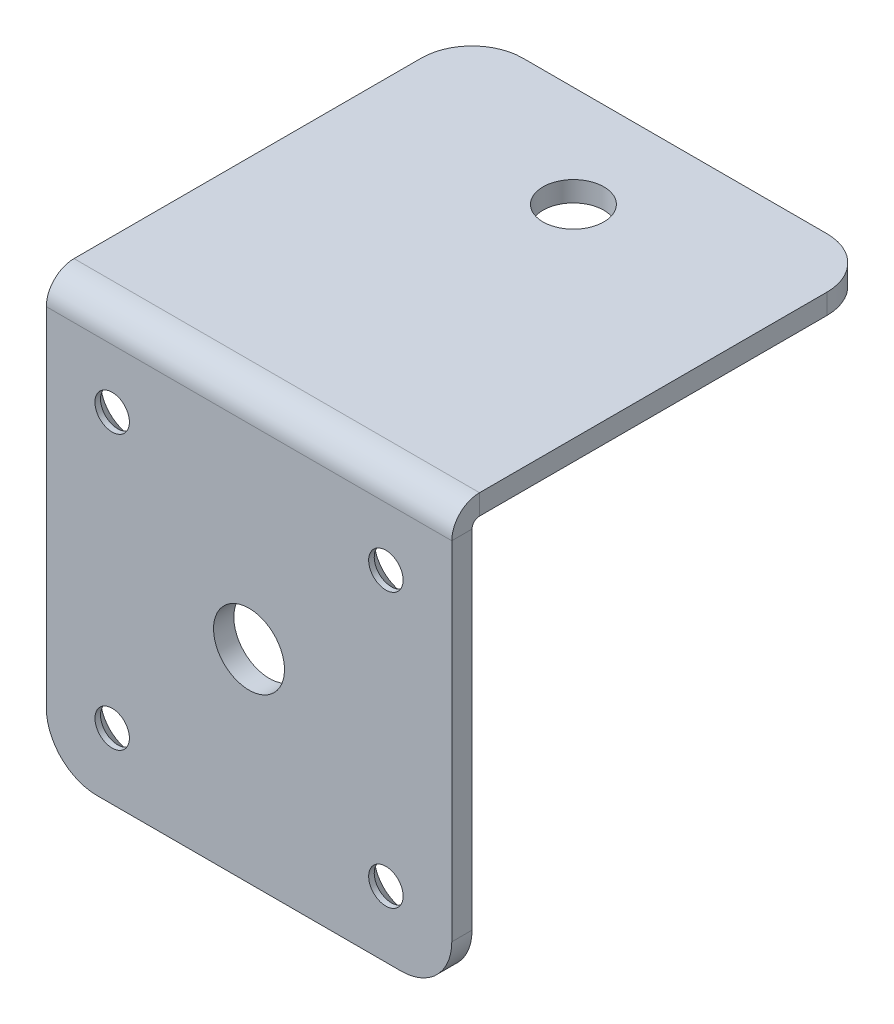
from build123d import *

# Parameters (mm, degrees)
SKETCH_1_W                       = 40
SKETCH_1_H                       = 2
SM_BASE_FLANGE_1_DEPTH           = 40
CUT_EXTRUDE_1_REACH              = 58.604
SKETCH_3_R                       = 3
SM_EDGE_FLANGE_1_STRIP_W         = 9.4732
SM_EDGE_FLANGE_1_STRIP_H         = 2
SM_EDGE_FLANGE_1_STRIP_CUT_DEPTH = 40
SM_EDGE_FLANGE_1_DEPTH           = 40
FILLET_1_R                       = 5
HOLE_WIZARD_M3_1_AT_2_COUNT      = 2
HOLE_WIZARD_M3_1_AT_2_PITCH      = 27
HOLE_WIZARD_M3_1_AT_3_COUNT      = 2
HOLE_WIZARD_M3_1_AT_3_PITCH      = 38.183766184
HOLE_WIZARD_M3_1_AT_4_COUNT      = 2
HOLE_WIZARD_M3_1_AT_4_PITCH      = 27
HOLE_WIZARD_7_0_7_1_D            = 7
HOLE_WIZARD_7_0_7_1_DEPTH        = 2
HOLE_WIZARD_7_0_7_1_TIP          = 2.103012167


# Sheet-metal steps are written as plain solids
with BuildPart() as part:
    # Sketch 1 → 基材-凸緣1 (new body)
    with BuildSketch(Plane.XY):
        with Locations((20, -1)):
            Rectangle(SKETCH_1_W, SKETCH_1_H)
    extrude(amount=SM_BASE_FLANGE_1_DEPTH)

    # 草圖3 → 除料-伸長1 (cut, up to next)
    with BuildSketch(Plane(origin=(0, 0, 0), x_dir=(-1, 0, 0), z_dir=(0, 1, 0)), mode=Mode.PRIVATE) as cut_extrude_1_sk1:
        with Locations(Location((-20, 10, 0), (0, 0, 90))):
            Circle(SKETCH_3_R)
    cut_extrude_1_tool1 = extrude(cut_extrude_1_sk1.sketch, amount=-CUT_EXTRUDE_1_REACH, mode=Mode.PRIVATE) & part.part
    add(cut_extrude_1_tool1.solids().sort_by_distance((20, 0, 10))[0], mode=Mode.SUBTRACT)

    # 邊線-凸緣1 strip (across the edge) → 邊線-凸緣1 strip cut (cut)
    with BuildSketch(Plane(origin=(40, -2, 40), x_dir=(0, 0, -1), z_dir=(-1, 0, 0))):
        with Locations((-4, -1)):
            Rectangle(SM_EDGE_FLANGE_1_STRIP_W, SM_EDGE_FLANGE_1_STRIP_H)
    extrude(amount=SM_EDGE_FLANGE_1_STRIP_CUT_DEPTH, mode=Mode.SUBTRACT)

    # 邊線-凸緣1 section (across the edge) → 邊線-凸緣1 (add)
    with BuildSketch(Plane(origin=(40, -2, 40), x_dir=(0, 0, -1), z_dir=(-1, 0, 0))):
        with BuildLine():
            Line((-2, 0.7366), (-2, 40))
            Line((-2, 40), (0, 40))
            Line((0, 40), (0, 0.7366))
            ThreePointArc((0, 0.7366), (0.215745145, 0.215745145), (0.7366, 0))
            Line((0.7366, 0), (0.7366, -2))
            ThreePointArc((0.7366, -2), (-1.198468417, -1.198468417), (-2, 0.7366))
        make_face()
    extrude(amount=SM_EDGE_FLANGE_1_DEPTH)

    # 圓角1
    fillet_1_edges = [part.edges().sort_by_distance(p)[0] for p in [
        (0, -1, 0),
        (40, -42, 41),
        (0, -42, 41),
        (40, -1, 0),
    ]]
    fillet(fillet_1_edges, radius=FILLET_1_R)

    # 草圖7 → M3 平錐坑頭螺釘的錐孔1 (revolve, cut)
    with BuildSketch(Plane(origin=(33.5, -35.5, 40), x_dir=(0, 1, 0), z_dir=(1, 0, 0))):
        Polygon((0, 0), (0, 2), (1.7, 2), (1.7, 1.45), (3.15, 0), align=None)
    hole_wizard_m3_1 = revolve(axis=Axis((33.5, -35.5, 33.65), (0, 0, 1)), mode=Mode.SUBTRACT)

    # M3 平錐坑頭螺釘的錐孔1 at 2: M3 平錐坑頭螺釘的錐孔1 ×2
    with Locations(*[(0, i * HOLE_WIZARD_M3_1_AT_2_PITCH, 0) for i in range(1, HOLE_WIZARD_M3_1_AT_2_COUNT)]):
        add(hole_wizard_m3_1, mode=Mode.SUBTRACT)

    # M3 平錐坑頭螺釘的錐孔1 at 3: M3 平錐坑頭螺釘的錐孔1 ×2
    with Locations(*[Vector(-0.7071067811865475, 0.7071067811865477, -2.465626675858965e-15) * (i * HOLE_WIZARD_M3_1_AT_3_PITCH) for i in range(1, HOLE_WIZARD_M3_1_AT_3_COUNT)]):
        add(hole_wizard_m3_1, mode=Mode.SUBTRACT)

    # M3 平錐坑頭螺釘的錐孔1 at 4: M3 平錐坑頭螺釘的錐孔1 ×2
    with Locations(*[(-i * HOLE_WIZARD_M3_1_AT_4_PITCH, 0, 0) for i in range(1, HOLE_WIZARD_M3_1_AT_4_COUNT)]):
        add(hole_wizard_m3_1, mode=Mode.SUBTRACT)

    # Ø7.0 (7) 直徑孔1
    with Locations(Plane(origin=(0, 0, 40), x_dir=(-1, 0, 0), z_dir=(0, 0, -1))):
        with Locations((-20, -22)):
            Hole(HOLE_WIZARD_7_0_7_1_D / 2, depth=HOLE_WIZARD_7_0_7_1_DEPTH)
            with Locations((0, 0, -(HOLE_WIZARD_7_0_7_1_DEPTH + HOLE_WIZARD_7_0_7_1_TIP / 2))):  # 118° drill point
                Cone(0, HOLE_WIZARD_7_0_7_1_D / 2, HOLE_WIZARD_7_0_7_1_TIP, mode=Mode.SUBTRACT)


solid = part.part
